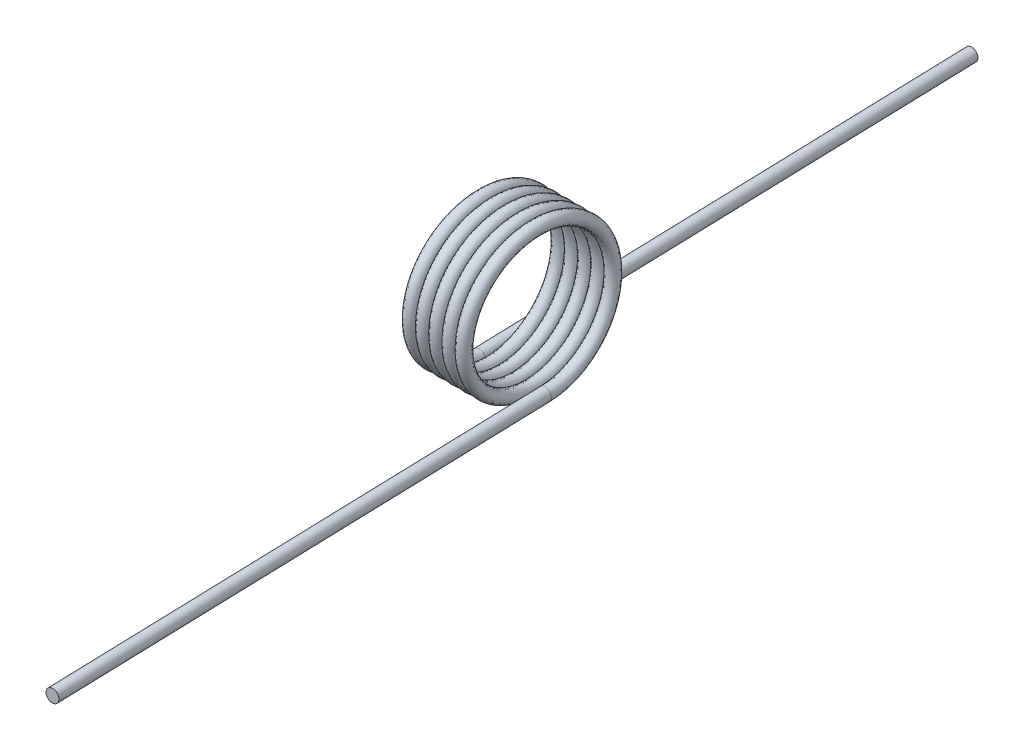
from build123d import *

# Parameters (mm, degrees)
SWEEP1_PITCH       = 0.6604
SWEEP1_HEIGHT      = 3.302
SWEEP1_RADIUS      = 3.556
SWEEP1_START_ANGLE = 90
SKETCH2_R          = 0.3175
SKETCH3_R          = 0.3175
EXTRUDE1_DEPTH     = 25.4
SKETCH4_R          = 0.3175
EXTRUDE2_DEPTH     = 25.4


with BuildPart() as part:
    # Sweep1: sweep along a helix
    with BuildLine() as sweep1_path:
        add(Helix(SWEEP1_PITCH, SWEEP1_HEIGHT, SWEEP1_RADIUS, center=(0, 0, 0), direction=(1, 0, 0), lefthand=True, mode=Mode.PRIVATE).rotate(Axis((0, 0, 0), (1, 0, 0)), SWEEP1_START_ANGLE))
    # Sketch2 → Sweep1 (sweep)
    with BuildSketch(Plane(origin=(0, -3.556, 0), x_dir=(0.9995634676389619, 2.6673088635058772e-14, -0.029544443835923), z_dir=(0.029544443835923, -1.0310142103403893e-14, 0.9995634676389619))):
        Circle(SKETCH2_R)
    sweep(path=sweep1_path.line, is_frenet=True)

    # Sketch3 → Extrude1 (add)
    with BuildSketch(Plane(origin=(0, 0, 0), x_dir=(-0.9995634676389619, -2.6645335722517008e-14, 0.029544443835922998), z_dir=(-0.029544443835922998, 1.0310142103403886e-14, -0.9995634676389619))):
        with Locations(Location((0, -3.556, 0), (0, 0, 180))):
            Circle(SKETCH3_R)
    extrude(amount=EXTRUDE1_DEPTH)

    # Sketch4 → Extrude2 (add)
    with BuildSketch(Plane(origin=(0.00288223, 0, 0.097513167), x_dir=(0.995894377903166, -0.0856032139747205, -0.0294359952789845), z_dir=(0.029544443835922998, 6.659126375319068e-14, 0.999563467638962))):
        with Locations(Location((3.592848265, -3.260408597, 0), (0, 0, 4.910712917))):
            Circle(SKETCH4_R)
    extrude(amount=EXTRUDE2_DEPTH)


solid = part.part
